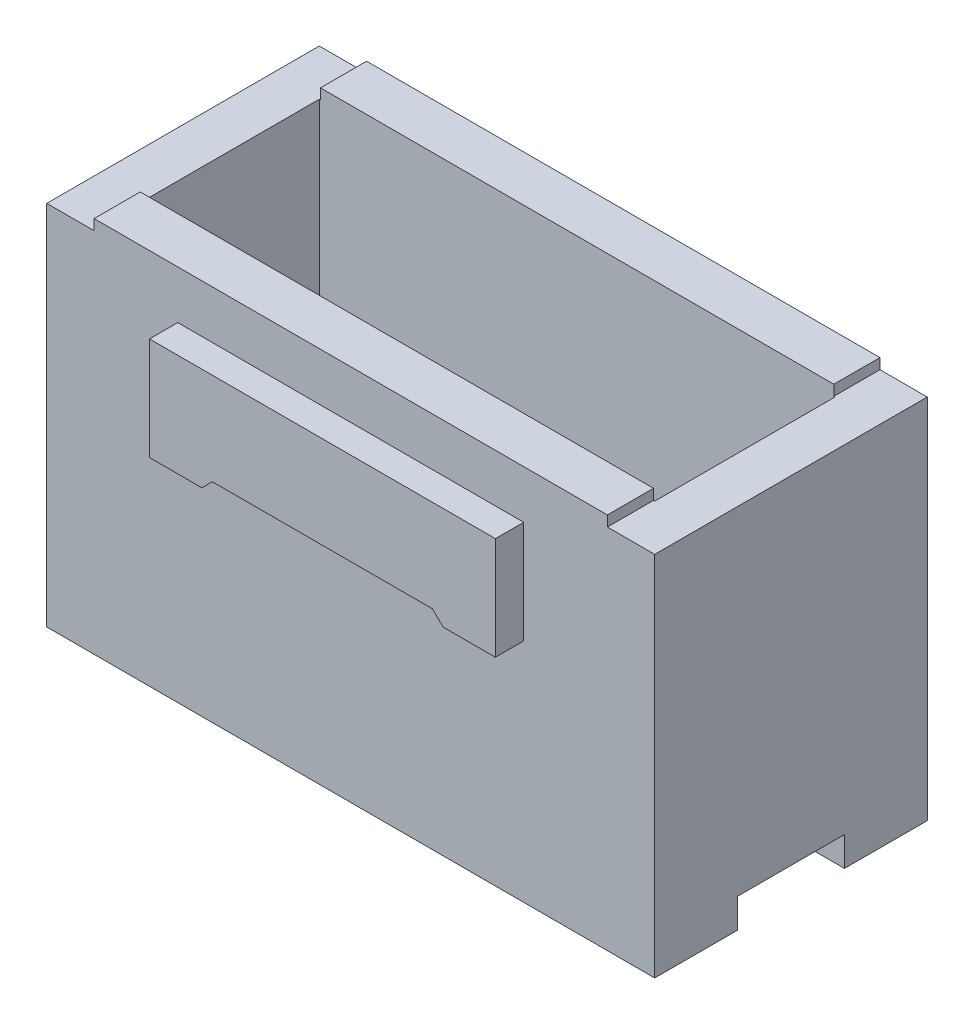
from build123d import *

# Parameters (mm, degrees)
SKETCH1_W                = 29
SKETCH1_H                = 18
BOSS_EXTRUDE1_DEPTH      = 13
BOSS_EXTRUDE2_DEPTH      = 1.35
BOSS_EXTRUDE2_DEPTH_BACK = 14.35
CUT_EXTRUDE1_DEPTH       = 1.4
SHELL1_START             = -5.4
SHELL1_OUTLINE_W         = 24.6
SHELL1_OUTLINE_H         = 8.6
SHELL1_DEPTH             = 14.4
SHELL1_START_2           = -6.8
SHELL1_2_DEPTH           = 1.4
SKETCH4_R                = 1.05
CUT_EXTRUDE2_DEPTH       = 27.300807972
SKETCH5_W                = 2.257483773
SKETCH5_H                = 13
CUT_EXTRUDE3_DEPTH       = 0.5


# Read off the part's stored shape, not the designer's step: Shell1
with BuildPart() as part:
    # Sketch1 → Boss-Extrude1 (new body)
    with BuildSketch(Plane.XY):
        Rectangle(SKETCH1_W, SKETCH1_H)
    extrude(amount=BOSS_EXTRUDE1_DEPTH)

    # Sketch2 → Boss-Extrude2 (add, two sides: drawn at the far end of the back side and taken through both)
    with BuildSketch(Plane.XY.offset(13).offset(-BOSS_EXTRUDE2_DEPTH_BACK)):
        Polygon((-5.75, 1.8), (-5.25, 2.3), (5.25, 2.3), (5.75, 1.8), (8.25, 1.8), (8.25, 6.7), (-8.25, 6.7), (-8.25, 1.8), align=None)
    extrude(amount=BOSS_EXTRUDE2_DEPTH + BOSS_EXTRUDE2_DEPTH_BACK)

    # Sketch3 → Cut-Extrude1 (cut)
    with BuildSketch(Plane.XZ.offset(9)):
        with BuildLine():
            Line((-2.55, -6.5), (-2.55, 6.5))
            ThreePointArc((-2.55, 6.5), (0, 9.05), (2.55, 6.5))
            Line((2.55, 6.5), (2.55, -6.5))
            ThreePointArc((2.55, -6.5), (0, -9.05), (-2.55, -6.5))
        make_face()
        with BuildLine():
            Line((-21, 9.05), (-8, 9.05))
            ThreePointArc((-8, 9.05), (-5.45, 6.5), (-8, 3.95))
            Line((-8, 3.95), (-21, 3.95))
            ThreePointArc((-21, 3.95), (-23.55, 6.5), (-21, 9.05))
        make_face()
        with BuildLine():
            Line((21, 9.05), (8, 9.05))
            ThreePointArc((8, 9.05), (5.45, 6.5), (8, 3.95))
            Line((8, 3.95), (21, 3.95))
            ThreePointArc((21, 3.95), (23.55, 6.5), (21, 9.05))
        make_face()
    extrude(amount=-CUT_EXTRUDE1_DEPTH, mode=Mode.SUBTRACT)

    # Shell1 outline → Shell1 (cut)
    with BuildSketch(Plane(origin=(0, 0, 0), x_dir=(1, 0, 0), z_dir=(0, 1, 0)).offset(SHELL1_START)):
        with Locations((0, -6.5)):
            Rectangle(SHELL1_OUTLINE_W, SHELL1_OUTLINE_H)
    extrude(amount=SHELL1_DEPTH, mode=Mode.SUBTRACT)

    # Shell1 2 outline → Shell1 2 (cut)
    with BuildSketch(Plane(origin=(0, 0, 0), x_dir=(1, 0, 0), z_dir=(0, 1, 0)).offset(SHELL1_START_2)):
        with BuildLine():
            Line((2.018043607, -10.8), (5.981956393, -10.8))
            ThreePointArc((5.981956393, -10.8), (4.867971715, -10.071120108), (4, -9.061737691))
            ThreePointArc((4, -9.061737691), (3.132028285, -10.071120108), (2.018043607, -10.8))
        make_face()
        with BuildLine():
            ThreePointArc((4.75, -3.035898385), (5.333025611, -2.569383304), (5.981956393, -2.2))
            Line((5.981956393, -2.2), (4.75, -2.2))
            Line((4.75, -2.2), (4.75, -3.035898385))
        make_face()
        with BuildLine():
            Line((-5.981956393, -10.8), (-2.018043607, -10.8))
            ThreePointArc((-2.018043607, -10.8), (-3.132028285, -10.071120108), (-4, -9.061737691))
            ThreePointArc((-4, -9.061737691), (-4.867971715, -10.071120108), (-5.981956393, -10.8))
        make_face()
        with BuildLine():
            Line((-4.75, -3.035898385), (-4.75, -2.2))
            Line((-4.75, -2.2), (-5.981956393, -2.2))
            ThreePointArc((-5.981956393, -2.2), (-5.333025611, -2.569383304), (-4.75, -3.035898385))
        make_face()
    extrude(amount=SHELL1_2_DEPTH, mode=Mode.SUBTRACT)

    # Sketch4 → Cut-Extrude2 (cut, through all)
    with BuildSketch(Plane.XZ.offset(7.6)):
        with Locations((0, 6.5)):
            Circle(SKETCH4_R)
        with Locations((-8, 6.5)):
            Circle(SKETCH4_R)
        with Locations((8, 6.5)):
            Circle(SKETCH4_R)
    extrude(amount=-CUT_EXTRUDE2_DEPTH, mode=Mode.SUBTRACT)

    # Sketch5 → Cut-Extrude3 (cut)
    with BuildSketch(Plane(origin=(0, 9, 0), x_dir=(1, 0, 0), z_dir=(0, 1, 0))):
        with Locations((-13.371258114, -6.5)):
            Rectangle(SKETCH5_W, SKETCH5_H)
        with Locations((13.371258114, -6.5)):
            Rectangle(SKETCH5_W, SKETCH5_H)
    extrude(amount=-CUT_EXTRUDE3_DEPTH, mode=Mode.SUBTRACT)


solid = part.part
